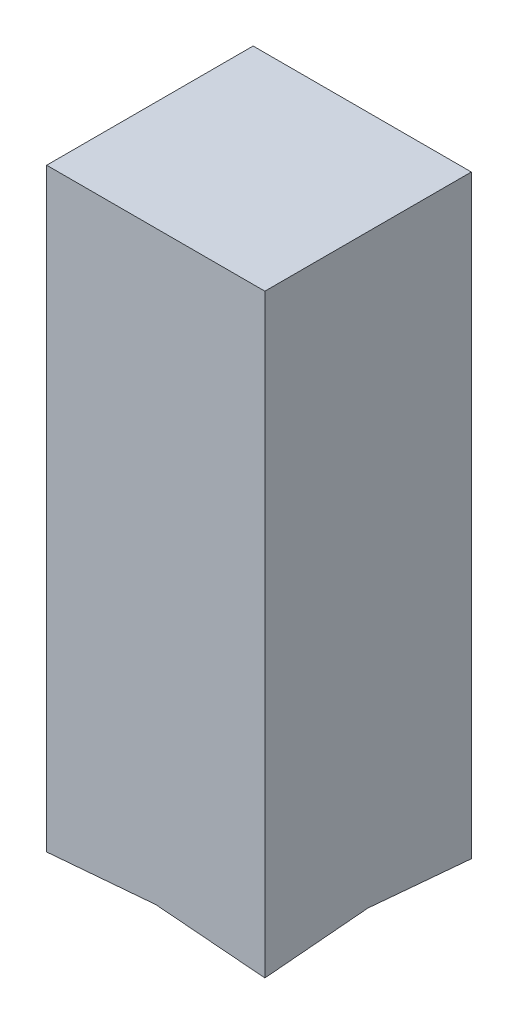
from build123d import *

# Parameters (mm, degrees)
SKETCH1_W           = 20.25
SKETCH1_H           = 19.16
BOSS_EXTRUDE1_DEPTH = 55.2
CUT_EXTRUDE2_DEPTH  = 60.572467634
CUT_EXTRUDE3_DEPTH  = 60.301443701


with BuildPart() as part:
    # Sketch1 → Boss-Extrude1 (new body)
    with BuildSketch(Plane(origin=(0, 0, 0), x_dir=(1, 0, 0), z_dir=(0, 1, 0))):
        Rectangle(SKETCH1_W, SKETCH1_H)
    extrude(amount=-BOSS_EXTRUDE1_DEPTH)

    # Sketch5 → Cut-Extrude2 (cut, through all)
    with BuildSketch(Plane(origin=(10.125, 0, 0), x_dir=(0, 0, -1), z_dir=(1, 0, 0))):
        Polygon((-9.58, -55.2), (0, -54.361858603), (9.58, -55.2), align=None)
    extrude(amount=-CUT_EXTRUDE2_DEPTH, mode=Mode.SUBTRACT)

    # Sketch6 → Cut-Extrude3 (cut, through all)
    with BuildSketch(Plane.XY.offset(9.58)):
        Polygon((-10.125, -55.2), (0, -54.361858603), (10.125, -55.2), align=None)
    extrude(amount=-CUT_EXTRUDE3_DEPTH, mode=Mode.SUBTRACT)


solid = part.part
